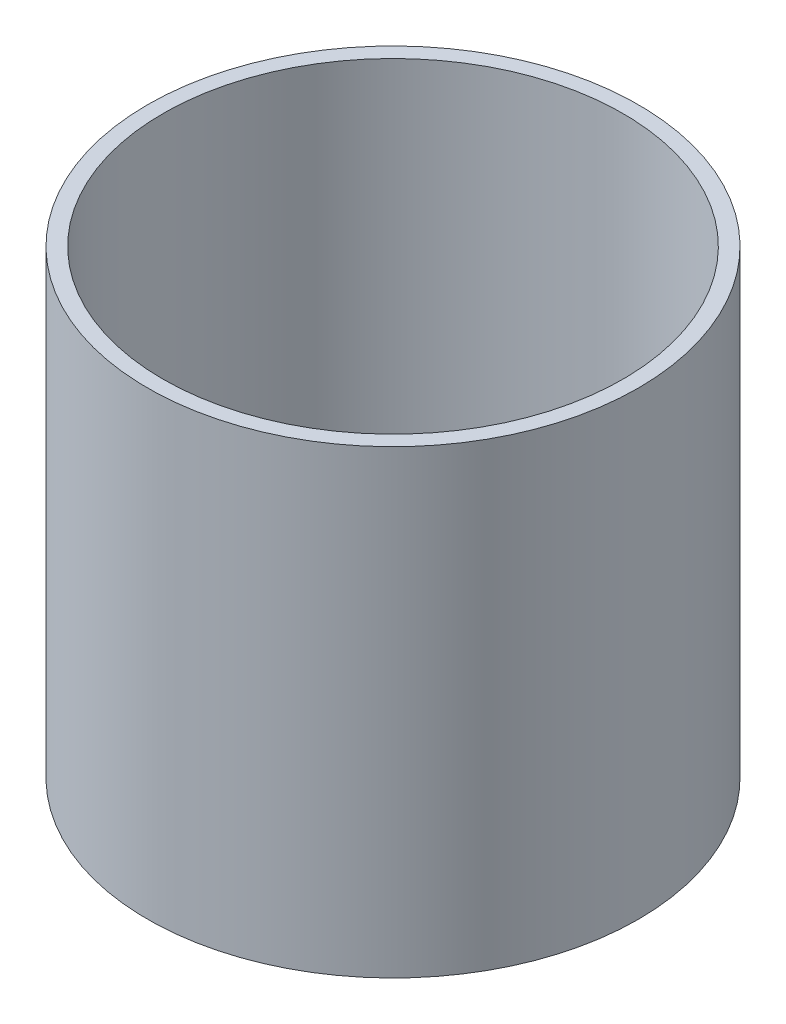
from build123d import *

# Parameters (mm, degrees)
SKETCH1_R           = 32
SKETCH1_R_2         = 30
EXTRUDE_THIN1_DEPTH = 60


with BuildPart() as part:
    # Sketch1 → Extrude-Thin1 (new body)
    with BuildSketch(Plane(origin=(0, 0, 0), x_dir=(1, 0, 0), z_dir=(0, 1, 0))):
        Circle(SKETCH1_R)
        Circle(SKETCH1_R_2, mode=Mode.SUBTRACT)
    extrude(amount=EXTRUDE_THIN1_DEPTH)


solid = part.part
